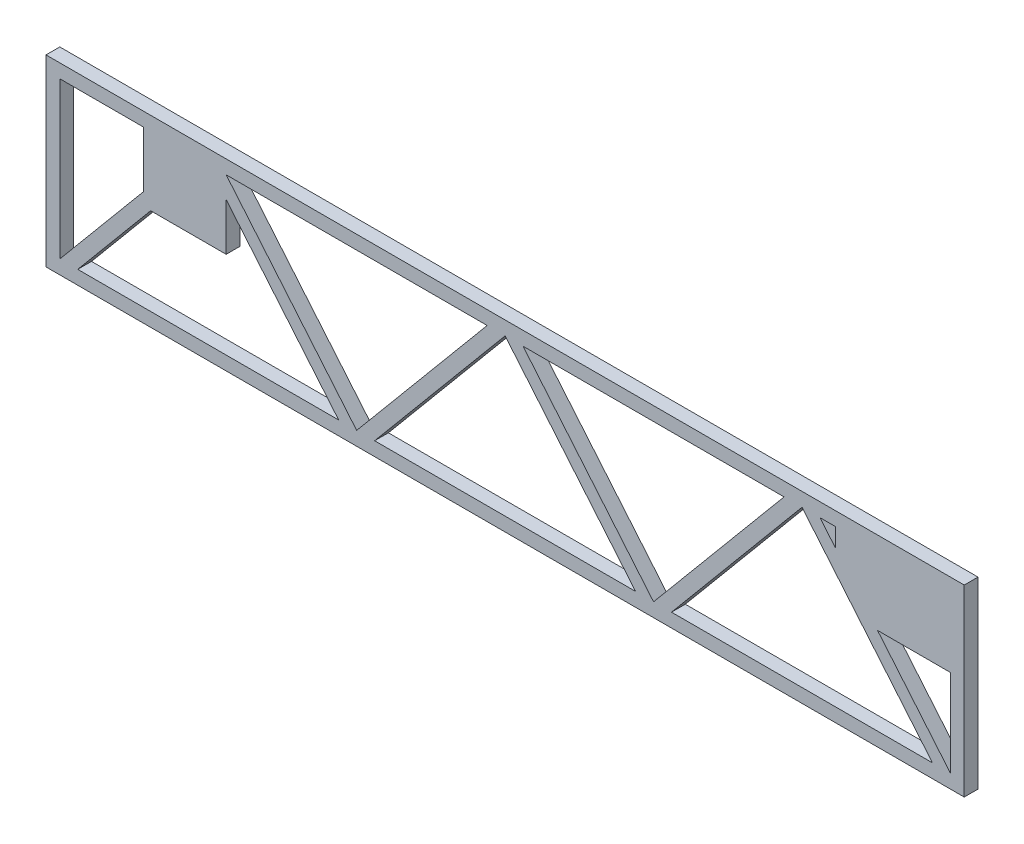
from build123d import *

# Parameters (mm, degrees)
SKETCH_1_W      = 200
SKETCH_1_H      = 40
EXTRUDE_1_DEPTH = 3


with BuildPart() as part:
    # 草图1 → 凸台-拉伸1 (new body)
    with BuildSketch(Plane.XY):
        Rectangle(SKETCH_1_W, SKETCH_1_H)
        Polygon((-36.243535317, -17), (-93.089798017, -17), (-77.206283439, 2), (-60.756464683, 2), (-60.756464683, 12.322581956), align=None, mode=Mode.SUBTRACT)
        Polygon((28.42313135, -17), (-28.42313135, -17), (0, 17), align=None, mode=Mode.SUBTRACT)
        Polygon((93.089798017, -17), (36.243535317, -17), (64.666666667, 17), align=None, mode=Mode.SUBTRACT)
        Polygon((97, 2), (97, -17), (81.116485422, 2), align=None, mode=Mode.SUBTRACT)
        Polygon((68.57686865, 17), (72, 17), (72, 12.905220137), align=None, mode=Mode.SUBTRACT)
        Polygon((3.910201983, 17), (60.756464683, 17), (32.333333333, -17), align=None, mode=Mode.SUBTRACT)
        Polygon((-60.756464683, 17), (-3.910201983, 17), (-32.333333333, -17), align=None, mode=Mode.SUBTRACT)
        Polygon((-97, 17), (-78.756464683, 17), (-78.756464683, 4.823077589), (-97, -17), align=None, mode=Mode.SUBTRACT)
    extrude(amount=EXTRUDE_1_DEPTH)


solid = part.part
